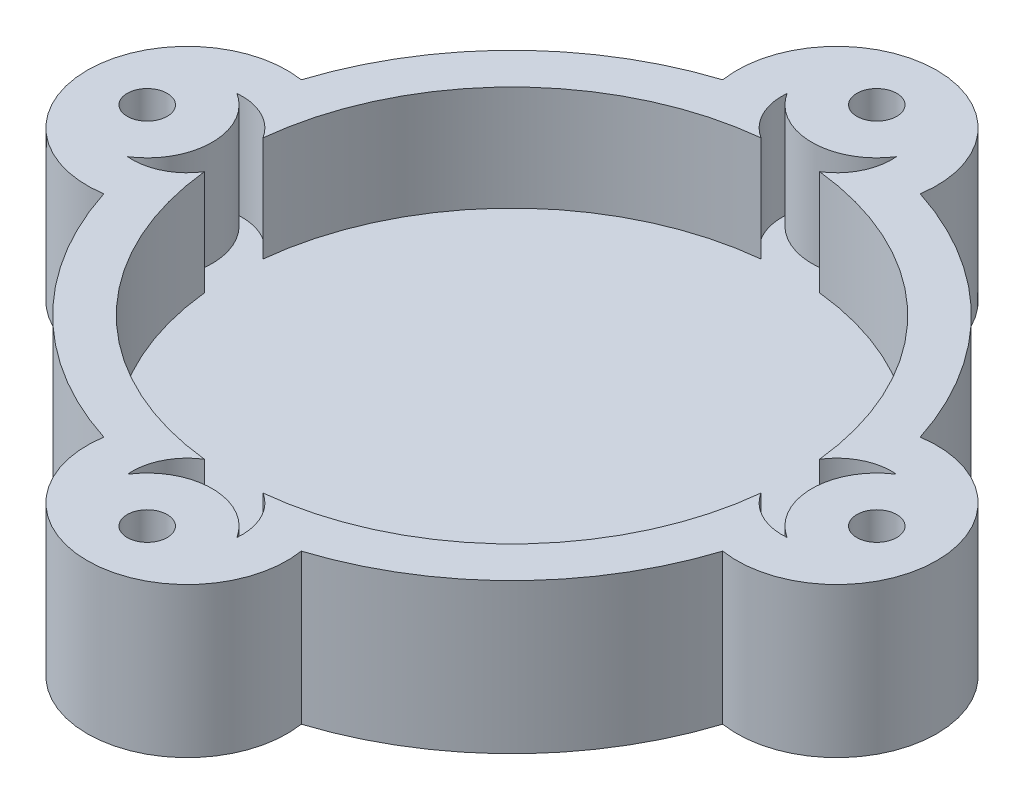
from build123d import *

# Parameters (mm, degrees)
SKETCH1_R           = 4
SKETCH1_R_2         = 65
BOSS_EXTRUDE1_DEPTH = 30
SHELL1_START        = 9
SHELL1_DEPTH        = 21


# Read off the part's stored shape, not the designer's step: Shell1
with BuildPart() as part:
    # Sketch1 → Boss-Extrude1 (new body)
    # profile 1 of 5: a face of its own
    with BuildSketch(Plane(origin=(0, 0, 0), x_dir=(1, 0, 0), z_dir=(0, 1, 0))):
        with BuildLine():
            ThreePointArc((-61.923076923, 19.761896275), (-85, 0), (-61.923076923, -19.761896275))
            ThreePointArc((-61.923076923, -19.761896275), (-65, 0), (-61.923076923, 19.761896275))
        make_face()
        with Locations(Location((-73, 0, 0), (0, 0, 270))):
            Circle(SKETCH1_R, mode=Mode.SUBTRACT)
    # profile 2 of 5: a face of its own
    with BuildSketch(Plane(origin=(0, 0, 0), x_dir=(1, 0, 0), z_dir=(0, 1, 0))):
        with BuildLine():
            ThreePointArc((-19.761896275, -61.923076923), (0, -85), (19.761896275, -61.923076923))
            ThreePointArc((19.761896275, -61.923076923), (0, -65), (-19.761896275, -61.923076923))
        make_face()
        with Locations(Location((0, -73, 0), (0, 0, 270))):
            Circle(SKETCH1_R, mode=Mode.SUBTRACT)
    # profile 3 of 5: a face of its own
    with BuildSketch(Plane(origin=(0, 0, 0), x_dir=(1, 0, 0), z_dir=(0, 1, 0))):
        Circle(SKETCH1_R_2)
    # profile 4 of 5: a face of its own
    with BuildSketch(Plane(origin=(0, 0, 0), x_dir=(1, 0, 0), z_dir=(0, 1, 0))):
        with BuildLine():
            ThreePointArc((65, 0), (64.226162893, -10), (61.923076923, -19.761896275))
            ThreePointArc((61.923076923, -19.761896275), (85, 0), (61.923076923, 19.761896275))
            ThreePointArc((61.923076923, 19.761896275), (64.226162893, 10), (65, 0))
        make_face()
        with Locations(Location((73, 0, 0), (0, 0, 270))):
            Circle(SKETCH1_R, mode=Mode.SUBTRACT)
    # profile 5 of 5: a face of its own
    with BuildSketch(Plane(origin=(0, 0, 0), x_dir=(1, 0, 0), z_dir=(0, 1, 0))):
        with BuildLine():
            ThreePointArc((-19.761896275, 61.923076923), (0, 65), (19.761896275, 61.923076923))
            ThreePointArc((19.761896275, 61.923076923), (0, 85), (-19.761896275, 61.923076923))
        make_face()
        with Locations(Location((0, 73, 0), (0, 0, 270))):
            Circle(SKETCH1_R, mode=Mode.SUBTRACT)
    extrude(amount=BOSS_EXTRUDE1_DEPTH)

    # Shell1 outline → Shell1 (cut)
    with BuildSketch(Plane(origin=(0, 0, 0), x_dir=(1, 0, 0), z_dir=(0, 1, 0)).offset(SHELL1_START)):
        with BuildLine():
            ThreePointArc((-66, -10.95445115), (-60.127949817, -9.862207005), (-55.692307692, -5.86232581))
            ThreePointArc((-55.692307692, -5.86232581), (-39.597979746, -39.597979746), (-5.86232581, -55.692307692))
            ThreePointArc((-5.86232581, -55.692307692), (-9.862207005, -60.127949817), (-10.95445115, -66))
            ThreePointArc((-10.95445115, -66), (0, -60), (10.95445115, -66))
            ThreePointArc((10.95445115, -66), (9.862207005, -60.127949817), (5.86232581, -55.692307692))
            ThreePointArc((5.86232581, -55.692307692), (39.597979746, -39.597979746), (55.692307692, -5.86232581))
            ThreePointArc((55.692307692, -5.86232581), (60.127949817, -9.862207005), (66, -10.95445115))
            ThreePointArc((66, -10.95445115), (60, 0), (66, 10.95445115))
            ThreePointArc((66, 10.95445115), (60.127949817, 9.862207005), (55.692307692, 5.86232581))
            ThreePointArc((55.692307692, 5.86232581), (39.597979746, 39.597979746), (5.86232581, 55.692307692))
            ThreePointArc((5.86232581, 55.692307692), (9.862207005, 60.127949817), (10.95445115, 66))
            ThreePointArc((10.95445115, 66), (0, 60), (-10.95445115, 66))
            ThreePointArc((-10.95445115, 66), (-9.862207005, 60.127949817), (-5.86232581, 55.692307692))
            ThreePointArc((-5.86232581, 55.692307692), (-39.597979746, 39.597979746), (-55.692307692, 5.86232581))
            ThreePointArc((-55.692307692, 5.86232581), (-60.127949817, 9.862207005), (-66, 10.95445115))
            ThreePointArc((-66, 10.95445115), (-60, 0), (-66, -10.95445115))
        make_face()
    extrude(amount=SHELL1_DEPTH, mode=Mode.SUBTRACT)


solid = part.part
